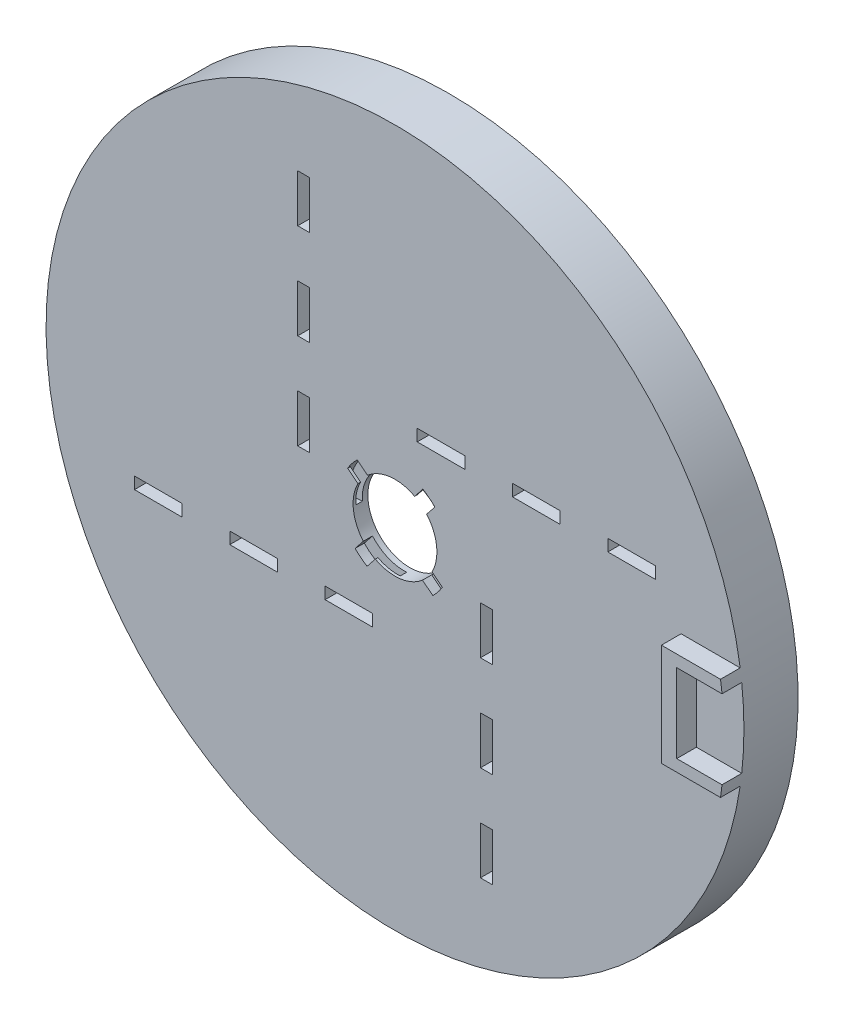
from build123d import *

# Parameters (mm, degrees)
SKETCH1_W           = 200
SKETCH1_H           = 200
SKETCH1_R           = 10.65
BOSS_EXTRUDE1_DEPTH = 3.75
CUT_EXTRUDE4_START  = -1.5
CUT_EXTRUDE4_DEPTH  = 0.825
CUT_EXTRUDE5_DEPTH  = 142.440466717
CIRPATTERN1_COUNT   = 4
SKETCH5_W           = 12.1
SKETCH5_H           = 3
CUT_EXTRUDE6_DEPTH  = 10
CIRPATTERN2_COUNT   = 4
SKETCH6_W           = 200
SKETCH6_H           = 200.182674684
SKETCH6_R           = 88.610994186
CUT_EXTRUDE7_DEPTH  = 142.471065946
BOSS_EXTRUDE2_START = -13.75
SKETCH8_R           = 86.110994186
SKETCH8_R_2         = 84.610994186
BOSS_EXTRUDE2_DEPTH = 13.75
BOSS_EXTRUDE3_DEPTH = 5


with BuildPart() as part:
    # Sketch1 → Boss-Extrude1 (new body)
    with BuildSketch(Plane.XY):
        Rectangle(SKETCH1_W, SKETCH1_H)
        Circle(SKETCH1_R, mode=Mode.SUBTRACT)
    extrude(amount=-BOSS_EXTRUDE1_DEPTH)

    # Sketch2 → Cut-Extrude4 (cut, symmetric)
    with BuildSketch(Plane.XY.offset(CUT_EXTRUDE4_START)):
        with BuildLine():
            Line((8.682868236, 10.918346907), (6.628856395, 8.335512155))
            ThreePointArc((6.628856395, 8.335512155), (3.815515862, 9.943054798), (0.648987911, 10.63020765))
            ThreePointArc((0.648987911, 10.63020765), (0.324644823, 10.645050763), (0, 10.65))
            ThreePointArc((0, 10.65), (-0.324644823, 10.645050763), (-0.648987911, 10.63020765))
            Line((-0.648987911, 10.63020765), (-0.850082756, 13.92407481))
            ThreePointArc((-0.850082756, 13.92407481), (-0.425238994, 13.943517196), (0, 13.95))
            ThreePointArc((0, 13.95), (0.425238994, 13.943517196), (0.850082756, 13.92407481))
            ThreePointArc((0.850082756, 13.92407481), (4.997788382, 13.024001355), (8.682868236, 10.918346907))
        make_face()
    cut_extrude4 = extrude(amount=CUT_EXTRUDE4_DEPTH, both=True, mode=Mode.SUBTRACT)

    # Sketch4 → Cut-Extrude5 (cut, through all)
    with BuildSketch(Plane.XY.offset(-2.325)):
        with BuildLine():
            Line((5.000342926, 9.403141529), (7.076920348, 12.021634597))
            ThreePointArc((7.076920348, 12.021634597), (7.89918002, 11.498063098), (8.682868236, 10.918346907))
            ThreePointArc((8.682868236, 10.918346907), (9.424158272, 10.285316761), (10.119430429, 9.602063726))
            Line((10.119430429, 9.602063726), (8.035757001, 6.989213791))
            ThreePointArc((8.035757001, 6.989213791), (7.363141404, 7.694585672), (6.628856395, 8.335512155))
            ThreePointArc((6.628856395, 8.335512155), (5.839051921, 8.906625212), (5.000342926, 9.403141529))
        make_face()
    cut_extrude5 = extrude(amount=CUT_EXTRUDE5_DEPTH, mode=Mode.SUBTRACT)

    # CirPattern1: Cut-Extrude4, Cut-Extrude5 ×4 about axis
    cirpattern1_axis = Axis((0, 0, 0), (0, 0, 1))
    add([cut_extrude4.rotate(cirpattern1_axis, i * 360 / CIRPATTERN1_COUNT) for i in range(1, CIRPATTERN1_COUNT)], mode=Mode.SUBTRACT)
    add([cut_extrude5.rotate(cirpattern1_axis, i * 360 / CIRPATTERN1_COUNT) for i in range(1, CIRPATTERN1_COUNT)], mode=Mode.SUBTRACT)

    # Sketch5 → Cut-Extrude6 (cut)
    with BuildSketch(Plane.XY):
        with Locations((11.7, 23.2)):
            Rectangle(SKETCH5_W, SKETCH5_H)
        with Locations((60.1, 23.2)):
            Rectangle(SKETCH5_W, SKETCH5_H)
        with Locations((35.9, 23.2)):
            Rectangle(SKETCH5_W, SKETCH5_H)
    cut_extrude6 = extrude(amount=-CUT_EXTRUDE6_DEPTH, mode=Mode.SUBTRACT)

    # CirPattern2: Cut-Extrude6 ×4 about axis
    cirpattern2_axis = Axis((0, 0, -3.75), (0, 0, 1))
    for i in range(1, CIRPATTERN2_COUNT):
        add(cut_extrude6.rotate(cirpattern2_axis, i * 360 / CIRPATTERN2_COUNT), mode=Mode.SUBTRACT)

    # Sketch6 → Cut-Extrude7 (cut, through all)
    with BuildSketch(Plane(origin=(0, 0, -3.75), x_dir=(-1, 0, 0), z_dir=(0, 0, -1))):
        with Locations((0, 0.091337342)):
            Rectangle(SKETCH6_W, SKETCH6_H)
        Circle(SKETCH6_R, mode=Mode.SUBTRACT)
    extrude(amount=-CUT_EXTRUDE7_DEPTH, mode=Mode.SUBTRACT)

    # Sketch8 → Boss-Extrude2 (add)
    # profile 1 of 2: a face of its own
    with BuildSketch(Plane.XY.offset(BOSS_EXTRUDE2_START)):
        with BuildLine():
            ThreePointArc((-88.273802601, -7.722957014), (88.610994186, 0), (-88.273802601, 7.722957014))
            Line((-88.273802601, 7.722957014), (-86.779510554, 7.5922234))
            ThreePointArc((-86.779510554, 7.5922234), (87.110994186, 0), (-86.779510554, -7.5922234))
            Line((-86.779510554, -7.5922234), (-88.273802601, -7.722957014))
        make_face()
    # profile 2 of 2: a face of its own
    with BuildSketch(Plane.XY.offset(BOSS_EXTRUDE2_START)):
        Circle(SKETCH8_R)
        Circle(SKETCH8_R_2, mode=Mode.SUBTRACT)
    extrude(amount=BOSS_EXTRUDE2_DEPTH)

    # Sketch11 → Boss-Extrude3 (add)
    with BuildSketch(Plane.XY):
        with BuildLine():
            Line((76.545964234, -10), (88.044922004, -10))
            ThreePointArc((88.044922004, -10), (87.861366557, -11.501676291), (87.652200718, -13))
            Line((87.652200718, -13), (72.652200718, -13))
            Line((72.652200718, -13), (72.652200718, 13))
            Line((72.652200718, 13), (87.652200718, 13))
            ThreePointArc((87.652200718, 13), (87.861366557, 11.501676291), (88.044922004, 10))
            Line((88.044922004, 10), (76.545964234, 10))
            Line((76.545964234, 10), (76.545964234, -10))
        make_face()
    extrude(amount=BOSS_EXTRUDE3_DEPTH)


solid = part.part
